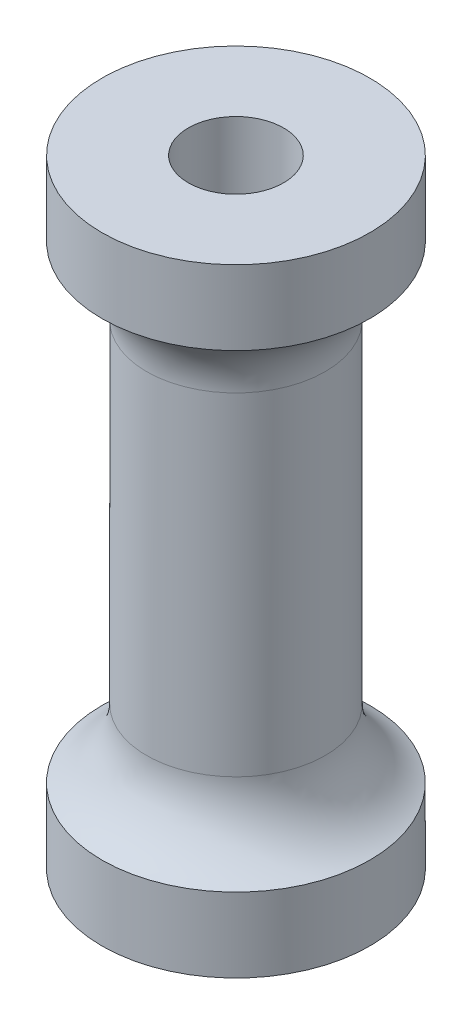
from build123d import *

# Parameters (mm, degrees)
SKETCH1_R           = 6
SKETCH1_R_2         = 3.2
BOSS_EXTRUDE1_DEPTH = 41.5
SKETCH2_W           = 3
SKETCH2_H           = 5
FILLET1_R           = 5


with BuildPart() as part:
    # Sketch1 → Boss-Extrude1 (new body)
    with BuildSketch(Plane(origin=(0, 0, 0), x_dir=(1, 0, 0), z_dir=(0, 1, 0))):
        with Locations(Location((0, 0, 0), (0, 0, 270))):
            Circle(SKETCH1_R)
        with Locations(Location((0, 0, 0), (0, 0, 270))):
            Circle(SKETCH1_R_2, mode=Mode.SUBTRACT)
    extrude(amount=BOSS_EXTRUDE1_DEPTH)

    # Sketch2 → Revolve1 (revolve)
    with BuildSketch(Plane.XY, mode=Mode.PRIVATE) as revolve1_sk:
        with Locations((7.5, 39)):
            Rectangle(SKETCH2_W, SKETCH2_H)
        with Locations((7.5, 2.5)):
            Rectangle(SKETCH2_W, SKETCH2_H)
    revolve(revolve1_sk.sketch.rotate(Axis((0, 42.288271676, 0), (0, -1, 0)), 90), axis=Axis((0, 42.288271676, 0), (0, -1, 0)))

    # Fillet1
    # the kernel refuses this fillet: 5 mm, written as the material it adds along each edge
    with BuildSketch(Plane(origin=(0, 5, 0), x_dir=(0, 0, 1), z_dir=(1, 0, 0))) as fillet1_piece_1:
        with BuildLine():
            CenterArc((11, -4.582575695), FILLET1_R, 113.578178478, 66.421821522)
            Line((9, 0), (8.96, 0.091651514))
            ThreePointArc((8.96, 0.091651514), (7.5, 0.1), (6, 0.1))
            Line((6, 0.1), (5.9, 0))
            Line((5.9, 0), (5.9, -4.582575695))
            Line((5.9, -4.582575695), (6, -4.582575695))
        make_face()
    revolve(axis=Axis((0, 5, 0), (0, -1, 0)))
    with BuildSketch(Plane(origin=(0, 36.5, 0), x_dir=(0, 0, 1), z_dir=(1, 0, 0))) as fillet1_piece_2:
        with BuildLine():
            CenterArc((11, 4.582575695), FILLET1_R, 180, 66.421821522)
            Line((9, 0), (8.96, -0.091651514))
            ThreePointArc((8.96, -0.091651514), (7.5, -0.1), (6, -0.1))
            Line((6, -0.1), (5.9, 0))
            Line((5.9, 0), (5.9, 4.582575695))
            Line((5.9, 4.582575695), (6, 4.582575695))
        make_face()
    revolve(axis=Axis((0, 36.5, 0), (0, -1, 0)))


solid = part.part
